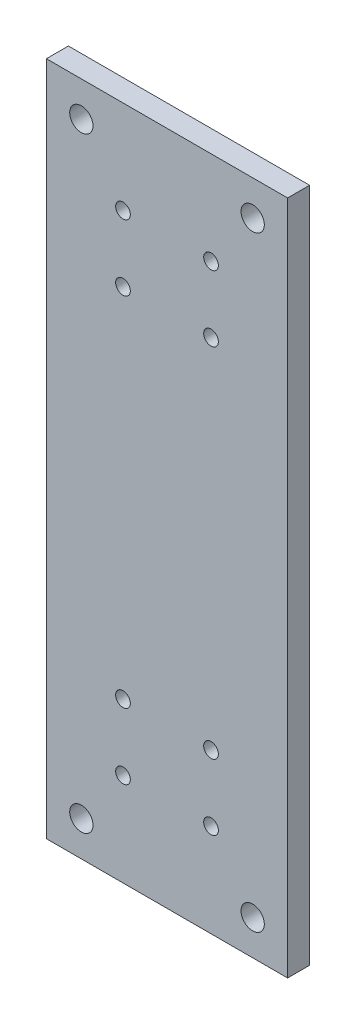
from build123d import *

# Parameters (mm, degrees)
SKETCH1_W           = 65.75
SKETCH1_H           = 184.15
SKETCH1_R           = 3.175
SKETCH1_R_2         = 2
BOSS_EXTRUDE1_DEPTH = 5.9944


with BuildPart() as part:
    # Sketch1 → Boss-Extrude1 (new body)
    with BuildSketch(Plane.XY):
        with Locations((32.875, 92.075)):
            Rectangle(SKETCH1_W, SKETCH1_H)
        with Locations((9.525, 9.525)):
            Circle(SKETCH1_R, mode=Mode.SUBTRACT)
        with Locations((56.225, 9.525)):
            Circle(SKETCH1_R, mode=Mode.SUBTRACT)
        with Locations((56.225, 174.625)):
            Circle(SKETCH1_R, mode=Mode.SUBTRACT)
        with Locations((9.525, 174.625)):
            Circle(SKETCH1_R, mode=Mode.SUBTRACT)
        with Locations((20.875, 158.75)):
            Circle(SKETCH1_R_2, mode=Mode.SUBTRACT)
        with Locations((44.875, 158.75)):
            Circle(SKETCH1_R_2, mode=Mode.SUBTRACT)
        with Locations((44.875, 140.75)):
            Circle(SKETCH1_R_2, mode=Mode.SUBTRACT)
        with Locations((20.875, 140.75)):
            Circle(SKETCH1_R_2, mode=Mode.SUBTRACT)
        with Locations((20.875, 43.4)):
            Circle(SKETCH1_R_2, mode=Mode.SUBTRACT)
        with Locations((44.875, 43.4)):
            Circle(SKETCH1_R_2, mode=Mode.SUBTRACT)
        with Locations((44.875, 25.4)):
            Circle(SKETCH1_R_2, mode=Mode.SUBTRACT)
        with Locations((20.875, 25.4)):
            Circle(SKETCH1_R_2, mode=Mode.SUBTRACT)
    extrude(amount=BOSS_EXTRUDE1_DEPTH)


solid = part.part
